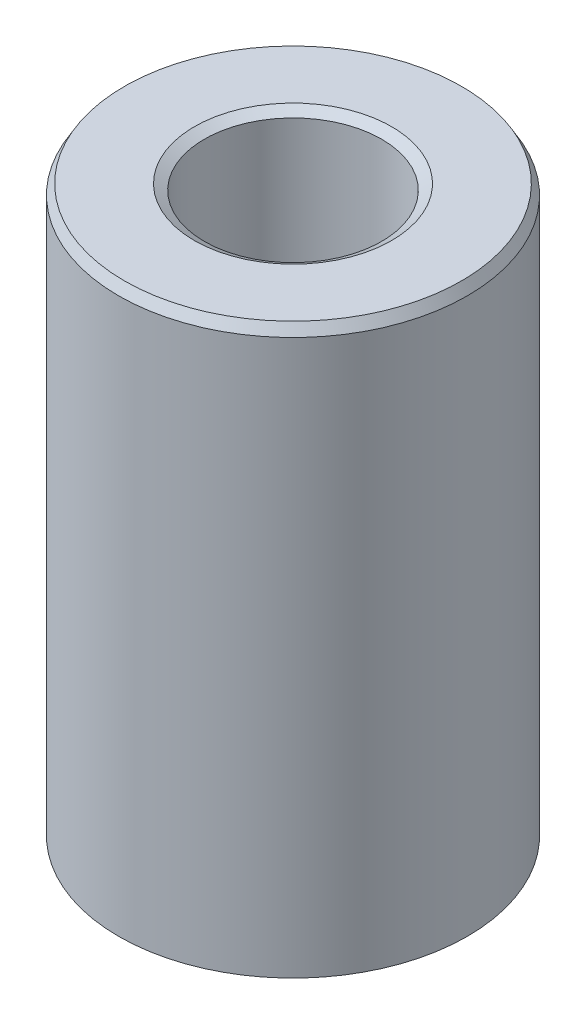
from build123d import *
from OCP.BRepFilletAPI import BRepFilletAPI_MakeChamfer

# Parameters (mm, degrees)
SKETCH1_R           = 42.5
BOSS_EXTRUDE1_DEPTH = 139.097010958
SKETCH2_R           = 21.607127483
CUT_EXTRUDE1_DEPTH  = 152.527154191
CHAMFER1_SIZE       = 2.446120867
CHAMFER1_SIZE2      = 1.412268541


with BuildPart() as part:
    # Sketch1 → Boss-Extrude1 (new body)
    with BuildSketch(Plane(origin=(0, 0, 0), x_dir=(1, 0, 0), z_dir=(0, 1, 0))):
        Circle(SKETCH1_R)
    extrude(amount=BOSS_EXTRUDE1_DEPTH)

    # Sketch2 → Cut-Extrude1 (cut, through all)
    with BuildSketch(Plane(origin=(0, 0, 0), x_dir=(1, 0, 0), z_dir=(0, 1, 0))):
        Circle(SKETCH2_R)
    extrude(amount=CUT_EXTRUDE1_DEPTH, mode=Mode.SUBTRACT)

    # Chamfer1: one chamfer whose edges measure the first distance from different faces: ONE call of the kernel's chamfer builder (chamfer() names one face for all edges)
    chamfer1_edges_1 = [part.edges().sort_by_distance(p)[0] for p in [
        (-21.607127483, 139.097010958, 0),
    ]]
    chamfer1_side_1 = [part.faces().sort_by_distance(p)[0] for p in [
        (-41.297918472, 139.097010958, 0),
    ]]
    chamfer1_edges_2 = [part.edges().sort_by_distance(p)[0] for p in [
        (-21.607127483, 0, 0),
    ]]
    chamfer1_side_2 = [part.faces().sort_by_distance(p)[0] for p in [
        (-21.607127483, 69.548505479, 0),
    ]]
    chamfer1_edges_3 = [part.edges().sort_by_distance(p)[0] for p in [
        (-42.5, 0, 0),
    ]]
    chamfer1_side_3 = [part.faces().sort_by_distance(p)[0] for p in [
        (-41.297918472, 0, 0),
    ]]
    chamfer1_edges_4 = [part.edges().sort_by_distance(p)[0] for p in [
        (-42.5, 139.097010958, 0),
    ]]
    chamfer1_side_4 = [part.faces().sort_by_distance(p)[0] for p in [
        (-42.5, 69.548505479, 0),
    ]]
    chamfer1 = BRepFilletAPI_MakeChamfer(part.part.solid().wrapped)
    for e in chamfer1_edges_1:
        chamfer1.Add(CHAMFER1_SIZE, CHAMFER1_SIZE2, e.wrapped, chamfer1_side_1[0].wrapped)  # the first distance lies on this face
    for e in chamfer1_edges_2:
        chamfer1.Add(CHAMFER1_SIZE, CHAMFER1_SIZE2, e.wrapped, chamfer1_side_2[0].wrapped)  # the first distance lies on this face
    for e in chamfer1_edges_3:
        chamfer1.Add(CHAMFER1_SIZE, CHAMFER1_SIZE2, e.wrapped, chamfer1_side_3[0].wrapped)  # the first distance lies on this face
    for e in chamfer1_edges_4:
        chamfer1.Add(CHAMFER1_SIZE, CHAMFER1_SIZE2, e.wrapped, chamfer1_side_4[0].wrapped)  # the first distance lies on this face
    add(Compound.cast(chamfer1.Shape()), mode=Mode.REPLACE)


solid = part.part
